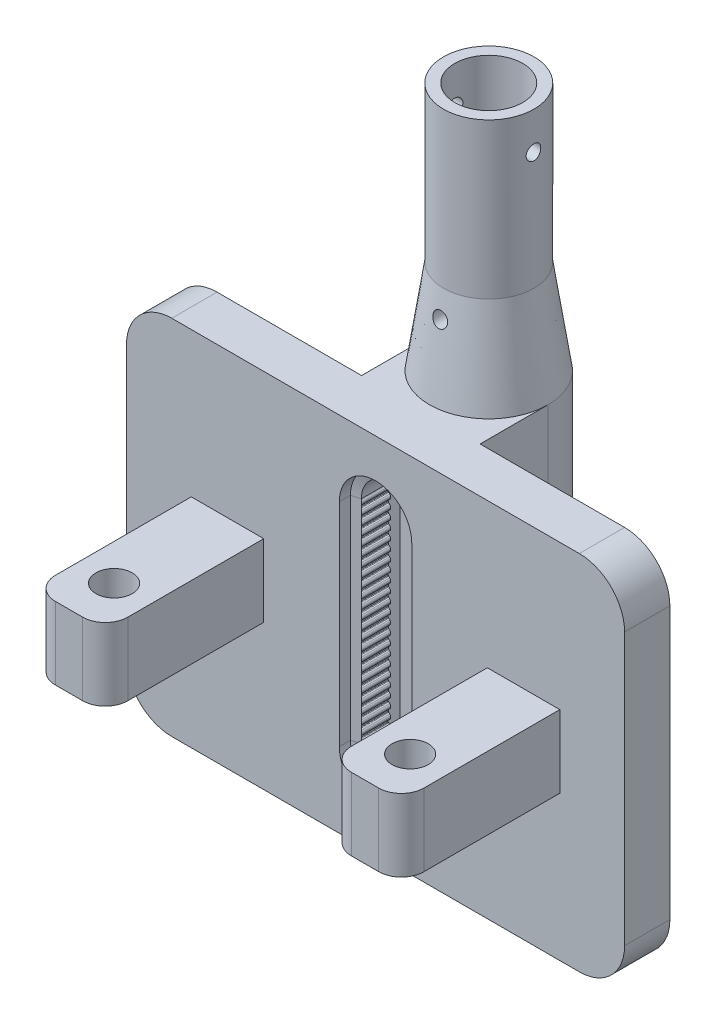
from build123d import *

# Parameters (mm, degrees)
SCHIZZO1_W                    = 110
SCHIZZO1_H                    = 80
ESTRUSIONE_ESTRUSIONE1_DEPTH  = 10
RACCORDO1_R                   = 10
SCHIZZO2_W                    = 12.22
SCHIZZO2_H                    = 55
ESTRUSIONE_ESTRUSIONE2_DEPTH  = 5
TAGLIO_ESTRUSIONE6_DEPTH      = 20
TAGLIO_ESTRUSIONE8_DEPTH      = 53
SCHIZZO14_R                   = 10
ESTRUSIONE_ESTRUSIONE5_DEPTH  = 135
SMUSSO1_SIZE                  = 2
SMUSSO1_SIZE2                 = 0.535898385
TAGLIO_ESTRUSIONE12_DEPTH     = 80
SMUSSO2_SIZE                  = 2
SMUSSO2_SIZE_2                = 0.535898385
ESTRUSIONE_ESTRUSIONE9_DEPTH  = 8
ESTRUSIONE_ESTRUSIONE10_DEPTH = 64
ESTRUSIONE_ESTRUSIONE11_DEPTH = 8
TAGLIO_ESTRUSIONE14_DEPTH     = 8
SCHIZZO32_W                   = 16
SCHIZZO32_H                   = 16
ESTRUSIONE_ESTRUSIONE13_DEPTH = 35
RACCORDO7_R                   = 5
SCHIZZO33_R                   = 4
TAGLIO_ESTRUSIONE16_DEPTH     = 35
RACCORDO7_OF_SPECCHIA1_R      = 5
SCHIZZO35_R                   = 7.5
TAGLIO_ESTRUSIONE17_DEPTH     = 47.44
SCHIZZO36_R                   = 1.62
TAGLIO_ESTRUSIONE18_DEPTH     = 45
SCHIZZO37_R                   = 1.62
TAGLIO_ESTRUSIONE19_DEPTH     = 22.5


with BuildPart() as part:
    # Schizzo1 → Estrusione-Estrusione1 (new body)
    with BuildSketch(Plane.XY):
        Rectangle(SCHIZZO1_W, SCHIZZO1_H)
    extrude(amount=ESTRUSIONE_ESTRUSIONE1_DEPTH)

    # Raccordo1
    raccordo1_edges = [part.edges().sort_by_distance(p)[0] for p in [
        (55, -40, 5),
        (-55, -40, 5),
        (-55, 40, 5),
        (55, 40, 5),
    ]]
    fillet(raccordo1_edges, radius=RACCORDO1_R)

    # Schizzo2 → Estrusione-Estrusione2 (add)
    with BuildSketch(Plane.XY.offset(10)):
        Rectangle(SCHIZZO2_W, SCHIZZO2_H)
    extrude(amount=-ESTRUSIONE_ESTRUSIONE2_DEPTH)

    # Schizzo6 → Taglio-Estrusione6 (cut)
    with BuildSketch(Plane.XY.offset(10)):
        with BuildLine():
            Line((-6.11, 21.385895057), (-6.11, -21.385895057))
            ThreePointArc((-6.11, -21.385895057), (0, -27.495895057), (6.11, -21.385895057))
            Line((6.11, -21.385895057), (6.11, 21.385895057))
            ThreePointArc((6.11, 21.385895057), (0, 27.495895057), (-6.11, 21.385895057))
        make_face()
    extrude(amount=-TAGLIO_ESTRUSIONE6_DEPTH, mode=Mode.SUBTRACT)

    # Schizzo9 → Taglio-Estrusione8 (cut)
    with BuildSketch(Plane(origin=(0, 0, 0), x_dir=(-1, 0, 0), z_dir=(0, 0, -1))):
        with BuildLine():
            Line((6.11, 23.431188104), (6.11, -23.431188104))
            ThreePointArc((6.11, -23.431188104), (0, -29.541188104), (-6.11, -23.431188104))
            Line((-6.11, -23.431188104), (-6.11, 23.431188104))
            ThreePointArc((-6.11, 23.431188104), (0, 29.541188104), (6.11, 23.431188104))
        make_face()
    extrude(amount=-TAGLIO_ESTRUSIONE8_DEPTH, mode=Mode.SUBTRACT)

    # Smusso1
    smusso1_edges = [part.edges().sort_by_distance(p)[0] for p in [
        (-6.11, 0, 0),
        (6.11, 0, 0),
        (0, 29.541188104, 0),
        (0, -29.541188104, 0),
    ]]
    smusso1_side = [part.faces().sort_by_distance(p)[0] for p in [
        (0, 38.639852949, 0),
    ]]
    chamfer(smusso1_edges, length=SMUSSO1_SIZE, length2=SMUSSO1_SIZE2, reference=smusso1_side[0])

    # Schizzo22 → Taglio-Estrusione12 (cut)
    with BuildSketch(Plane.XY.offset(7)):
        with BuildLine():
            Line((-8, 23.431188104), (-8, -23.431188104))
            ThreePointArc((-8, -23.431188104), (0, -31.431188104), (8, -23.431188104))
            Line((8, -23.431188104), (8, 23.431188104))
            ThreePointArc((8, 23.431188104), (0, 31.431188104), (-8, 23.431188104))
        make_face()
    extrude(amount=TAGLIO_ESTRUSIONE12_DEPTH, mode=Mode.SUBTRACT)

    # Smusso2
    # the kernel refuses this chamfer: 2, 0.535898385 mm, written as the material it adds along each edge
    with BuildSketch(Plane(origin=(0, -23.431188104, 7), x_dir=(-1, 0, 0), z_dir=(0, 1, 0))) as smusso2_piece_1_section:
        Polygon((8 - SMUSSO2_SIZE, 0), (8, SMUSSO2_SIZE_2), (8, 0), align=None)
    smusso2_piece_1 = revolve(axis=Axis((0, -23.431188104, 7), (0, 0, 1)), revolution_arc=180, mode=Mode.PRIVATE)
    smusso2_piece_1 = smusso2_piece_1 - Plane(origin=(0, -23.431188104, 7.272646598), x_dir=(-1, 0, 0), z_dir=(0, 0, -1)) * Cylinder(6.11, 32, mode=Mode.PRIVATE)
    add(smusso2_piece_1)
    with BuildSketch(Plane(origin=(-8, 23.431188104, 7), x_dir=(0.9999503267608395, 0, -0.009967146577156399), z_dir=(0, -1, 0))) as smusso2_piece_2_section:
        Polygon((SMUSSO2_SIZE * 0.999950326761, SMUSSO2_SIZE * 0.00996714657716), (-SMUSSO2_SIZE_2 * 0.00996714657459, SMUSSO2_SIZE_2 * 0.999950326504), (0, 0), align=None)
    smusso2_piece_2 = extrude(amount=46.862376207, mode=Mode.PRIVATE)
    smusso2_piece_2 = split(smusso2_piece_2, bisect_by=Plane(origin=(-6.11, 0, 7.161278996), z_dir=(-1, 0, 0)), keep=Keep.TOP, mode=Mode.PRIVATE)
    add(smusso2_piece_2)
    with BuildSketch(Plane(origin=(0, 23.431188104, 7), x_dir=(1, 0, 0), z_dir=(0, -1, 0))) as smusso2_piece_3_section:
        Polygon((8 - SMUSSO2_SIZE, 0), (8, SMUSSO2_SIZE_2), (8, 0), align=None)
    smusso2_piece_3 = revolve(axis=Axis((0, 23.431188104, 7), (0, 0, 1)), revolution_arc=180, mode=Mode.PRIVATE)
    smusso2_piece_3 = smusso2_piece_3 - Plane(origin=(0, 23.431188104, 7.272646598), x_dir=(1, 0, 0), z_dir=(0, 0, -1)) * Cylinder(6.11, 32, mode=Mode.PRIVATE)
    add(smusso2_piece_3)
    with BuildSketch(Plane(origin=(8, -23.431188104, 7), x_dir=(-0.9999503267608395, 0, -0.009967146577156399), z_dir=(0, 1, 0))) as smusso2_piece_4_section:
        Polygon((SMUSSO2_SIZE * 0.999950326761, SMUSSO2_SIZE * 0.00996714657716), (-SMUSSO2_SIZE_2 * 0.00996714657459, SMUSSO2_SIZE_2 * 0.999950326504), (0, 0), align=None)
    smusso2_piece_4 = extrude(amount=46.862376207, mode=Mode.PRIVATE)
    smusso2_piece_4 = split(smusso2_piece_4, bisect_by=Plane(origin=(6.11, 0, 7.161278996), z_dir=(1, 0, 0)), keep=Keep.TOP, mode=Mode.PRIVATE)
    add(smusso2_piece_4)



with BuildPart() as body_2:
    # Schizzo14 → Estrusione-Estrusione5 (new body)
    with BuildSketch(Plane(origin=(0, 95, 0), x_dir=(1, 0, 0), z_dir=(0, 1, 0))):
        with Locations(Location((0, 15, 0), (0, 0, 270))):
            Circle(SCHIZZO14_R)
    extrude(amount=-ESTRUSIONE_ESTRUSIONE5_DEPTH)


with BuildPart() as part_1:
    add(part.part)

    add(body_2.part)  # Estrusione-Estrusione9 merges body 2
    # Schizzo20 → Estrusione-Estrusione9 (add)
    with BuildSketch(Plane(origin=(0, -40, 0), x_dir=(1, 0, 0), z_dir=(0, 1, 0))):
        with BuildLine():
            Line((-13.086207835, 15), (-13.086207835, 0))
            Line((-13.086207835, 0), (13.086207835, 0))
            Line((13.086207835, 0), (13.086207835, 15))
            ThreePointArc((13.086207835, 15), (0, 28.086207835), (-13.086207835, 15))
        make_face()
    extrude(amount=ESTRUSIONE_ESTRUSIONE9_DEPTH)

    # Schizzo23 → Estrusione-Estrusione10 (add)
    with BuildSketch(Plane(origin=(0, -32, 0), x_dir=(1, 0, 0), z_dir=(0, 1, 0))):
        with BuildLine():
            Line((-13.086207835, 15), (-13.086207835, 0))
            Line((-13.086207835, 0), (-8.586207835, 0))
            Line((-8.586207835, 0), (-6.586207835, 2))
            Line((-6.586207835, 2), (6.586207835, 2))
            Line((6.586207835, 2), (8.586207835, 0))
            Line((8.586207835, 0), (13.086207835, 0))
            Line((13.086207835, 0), (13.086207835, 15))
            ThreePointArc((13.086207835, 15), (0, 28.086207835), (-13.086207835, 15))
        make_face()
    extrude(amount=ESTRUSIONE_ESTRUSIONE10_DEPTH)

    # Schizzo24 → Estrusione-Estrusione11 (add)
    with BuildSketch(Plane(origin=(0, 32, 0), x_dir=(1, 0, 0), z_dir=(0, 1, 0))):
        with BuildLine():
            Line((-13.086207835, 15), (-13.086207835, 0))
            Line((-13.086207835, 0), (13.086207835, 0))
            Line((13.086207835, 0), (13.086207835, 15))
            ThreePointArc((13.086207835, 15), (0, 28.086207835), (-13.086207835, 15))
        make_face()
    extrude(amount=ESTRUSIONE_ESTRUSIONE11_DEPTH)

    # Schizzo25 → Rivoluzione6 (revolve)
    with BuildSketch(Plane(origin=(0, 0, 0), x_dir=(0, 0, -1), z_dir=(1, 0, 0)), mode=Mode.PRIVATE) as rivoluzione6_sk:
        Polygon((15, 40), (28.086207835, 40), (25, 60.729020971), (15, 60.729020971), align=None)
    revolve(rivoluzione6_sk.sketch.rotate(Axis((0, 40, -15), (0, 1, 0)), 270), axis=Axis((0, 40, -15), (0, 1, 0)))

    # Schizzo26 → Taglio-Estrusione14 (cut)
    with BuildSketch(Plane.XY.offset(7)):
        with BuildLine():
            Line((1.378490081, -23.431477614), (-1.377875263, -23.43101277))
            Line((-1.377875263, -23.43101277), (-6.157754478, -23.43101277))
            ThreePointArc((-6.157754478, -23.43101277), (-6.265509908, -23.271432682), (-6.421299684, -23.158266507))
            ThreePointArc((-6.421299684, -23.158266507), (-6.571812894, -23.099373904), (-6.729849965, -23.065508738))
            ThreePointArc((-6.729849965, -23.065508738), (-6.822601249, -23.016000408), (-6.85965898, -22.917610368))
            Line((-6.85965898, -22.917610368), (-6.859693276, -22.393414393))
            ThreePointArc((-6.859693276, -22.393414393), (-6.82264842, -22.295019504), (-6.729903615, -22.245499038))
            ThreePointArc((-6.729903615, -22.245499038), (-6.571870977, -22.211613193), (-6.421365474, -22.152700895))
            ThreePointArc((-6.421365474, -22.152700895), (-6.109735126, -21.654479431), (-6.420236093, -21.155553333))
            ThreePointArc((-6.420236093, -21.155553333), (-6.57060776, -21.096300258), (-6.728563234, -21.062056521))
            ThreePointArc((-6.728563234, -21.062056521), (-6.821195626, -21.012326094), (-6.858017501, -20.913847543))
            Line((-6.858017501, -20.913847543), (-6.857406643, -20.651750267))
            Line((-6.857406643, -20.651750267), (-6.858017501, -20.389652991))
            ThreePointArc((-6.858017501, -20.389652991), (-6.821195626, -20.29117444), (-6.728563234, -20.241444013))
            ThreePointArc((-6.728563234, -20.241444013), (-6.57060776, -20.207200276), (-6.420236093, -20.147947201))
            ThreePointArc((-6.420236093, -20.147947201), (-6.109735126, -19.649021103), (-6.421365474, -19.150799639))
            ThreePointArc((-6.421365474, -19.150799639), (-6.571870977, -19.091887342), (-6.729903615, -19.058001496))
            ThreePointArc((-6.729903615, -19.058001496), (-6.82264842, -19.00848103), (-6.859693276, -18.910086141))
            Line((-6.859693276, -18.910086141), (-6.85965898, -18.385890166))
            ThreePointArc((-6.85965898, -18.385890166), (-6.822601249, -18.287500126), (-6.729849965, -18.237991796))
            ThreePointArc((-6.729849965, -18.237991796), (-6.571812894, -18.20412663), (-6.421299684, -18.145234027))
            ThreePointArc((-6.421299684, -18.145234027), (-6.109604144, -17.647053345), (-6.420039823, -17.148086622))
            ThreePointArc((-6.420039823, -17.148086622), (-6.570403735, -17.088813871), (-6.728354727, -17.054549464))
            ThreePointArc((-6.728354727, -17.054549464), (-6.820980611, -17.004806917), (-6.857789599, -16.906323549))
            Line((-6.857789599, -16.906323549), (-6.857144445, -16.644226355))
            Line((-6.857144445, -16.644226355), (-6.857789599, -16.382129161))
            ThreePointArc((-6.857789599, -16.382129161), (-6.820980611, -16.283645792), (-6.728354727, -16.233903245))
            ThreePointArc((-6.728354727, -16.233903245), (-6.570403735, -16.199638839), (-6.420039823, -16.140366088))
            ThreePointArc((-6.420039823, -16.140366088), (-6.109604144, -15.641399364), (-6.421299684, -15.143218682))
            ThreePointArc((-6.421299684, -15.143218682), (-6.571812894, -15.084326079), (-6.729849965, -15.050460913))
            ThreePointArc((-6.729849965, -15.050460913), (-6.822601249, -15.000952583), (-6.85965898, -14.902562543))
            Line((-6.85965898, -14.902562543), (-6.859693276, -14.378366568))
            ThreePointArc((-6.859693276, -14.378366568), (-6.82264842, -14.27997168), (-6.729903615, -14.230451213))
            ThreePointArc((-6.729903615, -14.230451213), (-6.571870977, -14.196565368), (-6.421365474, -14.13765307))
            ThreePointArc((-6.421365474, -14.13765307), (-6.109735126, -13.639431606), (-6.420236093, -13.140505508))
            ThreePointArc((-6.420236093, -13.140505508), (-6.57060776, -13.081252434), (-6.728563234, -13.047008696))
            ThreePointArc((-6.728563234, -13.047008696), (-6.821195626, -12.997278269), (-6.858017501, -12.898799718))
            Line((-6.858017501, -12.898799718), (-6.857406643, -12.636702442))
            Line((-6.857406643, -12.636702442), (-6.858017501, -12.374605166))
            ThreePointArc((-6.858017501, -12.374605166), (-6.821195626, -12.276126615), (-6.728563234, -12.226396188))
            ThreePointArc((-6.728563234, -12.226396188), (-6.57060776, -12.192152451), (-6.420236093, -12.132899376))
            ThreePointArc((-6.420236093, -12.132899376), (-6.109735126, -11.633973278), (-6.421365474, -11.135751814))
            ThreePointArc((-6.421365474, -11.135751814), (-6.571870977, -11.076839517), (-6.729903615, -11.042953671))
            ThreePointArc((-6.729903615, -11.042953671), (-6.82264842, -10.993433205), (-6.859693276, -10.895038316))
            Line((-6.859693276, -10.895038316), (-6.85965898, -10.370842341))
            ThreePointArc((-6.85965898, -10.370842341), (-6.822601249, -10.272452301), (-6.729849965, -10.222943971))
            ThreePointArc((-6.729849965, -10.222943971), (-6.571812894, -10.189078805), (-6.421299684, -10.130186202))
            ThreePointArc((-6.421299684, -10.130186202), (-6.109604144, -9.63200552), (-6.420039823, -9.133038797))
            ThreePointArc((-6.420039823, -9.133038797), (-6.570403735, -9.073766046), (-6.728354727, -9.03950164))
            ThreePointArc((-6.728354727, -9.03950164), (-6.820980611, -8.989759092), (-6.857789599, -8.891275724))
            Line((-6.857789599, -8.891275724), (-6.857144445, -8.62917853))
            Line((-6.857144445, -8.62917853), (-6.857789599, -8.367081336))
            ThreePointArc((-6.857789599, -8.367081336), (-6.820980611, -8.268597967), (-6.728354727, -8.21885542))
            ThreePointArc((-6.728354727, -8.21885542), (-6.570403735, -8.184591014), (-6.420039823, -8.125318263))
            ThreePointArc((-6.420039823, -8.125318263), (-6.109604144, -7.62635154), (-6.421299684, -7.128170858))
            ThreePointArc((-6.421299684, -7.128170858), (-6.571812894, -7.069278254), (-6.729849965, -7.035413088))
            ThreePointArc((-6.729849965, -7.035413088), (-6.822601249, -6.985904758), (-6.85965898, -6.887514718))
            Line((-6.85965898, -6.887514718), (-6.859693276, -6.363318743))
            ThreePointArc((-6.859693276, -6.363318743), (-6.82264842, -6.264923855), (-6.729903615, -6.215403388))
            ThreePointArc((-6.729903615, -6.215403388), (-6.571870977, -6.181517543), (-6.421365474, -6.122605245))
            ThreePointArc((-6.421365474, -6.122605245), (-6.109735126, -5.624383781), (-6.420236093, -5.125457684))
            ThreePointArc((-6.420236093, -5.125457684), (-6.57060776, -5.066204609), (-6.728563234, -5.031960871))
            ThreePointArc((-6.728563234, -5.031960871), (-6.821195626, -4.982230444), (-6.858017501, -4.883751893))
            Line((-6.858017501, -4.883751893), (-6.857406643, -4.621654617))
            Line((-6.857406643, -4.621654617), (-6.858017501, -4.359557341))
            ThreePointArc((-6.858017501, -4.359557341), (-6.821195626, -4.26107879), (-6.728563234, -4.211348363))
            ThreePointArc((-6.728563234, -4.211348363), (-6.57060776, -4.177104626), (-6.420236093, -4.117851551))
            ThreePointArc((-6.420236093, -4.117851551), (-6.109735126, -3.618925453), (-6.421365474, -3.120703989))
            ThreePointArc((-6.421365474, -3.120703989), (-6.571870977, -3.061791692), (-6.729903615, -3.027905846))
            ThreePointArc((-6.729903615, -3.027905846), (-6.82264842, -2.97838538), (-6.859693276, -2.879990491))
            Line((-6.859693276, -2.879990491), (-6.85965898, -2.355794517))
            ThreePointArc((-6.85965898, -2.355794517), (-6.822601249, -2.257404476), (-6.729849965, -2.207896146))
            ThreePointArc((-6.729849965, -2.207896146), (-6.571812894, -2.17403098), (-6.421299684, -2.115138377))
            ThreePointArc((-6.421299684, -2.115138377), (-6.109604144, -1.616957695), (-6.420039823, -1.117990972))
            ThreePointArc((-6.420039823, -1.117990972), (-6.570403735, -1.058718221), (-6.728354727, -1.024453815))
            ThreePointArc((-6.728354727, -1.024453815), (-6.820980611, -0.974711267), (-6.857789599, -0.876227899))
            Line((-6.857789599, -0.876227899), (-6.857144445, -0.614130705))
            Line((-6.857144445, -0.614130705), (-6.857789599, -0.352033511))
            ThreePointArc((-6.857789599, -0.352033511), (-6.820980611, -0.253550143), (-6.728354727, -0.203807595))
            ThreePointArc((-6.728354727, -0.203807595), (-6.570403735, -0.169543189), (-6.420039823, -0.110270438))
            ThreePointArc((-6.420039823, -0.110270438), (-6.109604144, 0.388696285), (-6.421299684, 0.886876967))
            ThreePointArc((-6.421299684, 0.886876967), (-6.571812894, 0.945769571), (-6.729849965, 0.979634737))
            ThreePointArc((-6.729849965, 0.979634737), (-6.822601249, 1.029143067), (-6.85965898, 1.127533107))
            Line((-6.85965898, 1.127533107), (-6.859693276, 1.651729082))
            ThreePointArc((-6.859693276, 1.651729082), (-6.82264842, 1.75012397), (-6.729903615, 1.799644437))
            ThreePointArc((-6.729903615, 1.799644437), (-6.571870977, 1.833530282), (-6.421365474, 1.89244258))
            ThreePointArc((-6.421365474, 1.89244258), (-6.109735126, 2.390664044), (-6.420236093, 2.889590141))
            ThreePointArc((-6.420236093, 2.889590141), (-6.57060776, 2.948843216), (-6.728563234, 2.983086954))
            ThreePointArc((-6.728563234, 2.983086954), (-6.821195626, 3.032817381), (-6.858017501, 3.131295932))
            Line((-6.858017501, 3.131295932), (-6.857406643, 3.393393208))
            Line((-6.857406643, 3.393393208), (-6.858017501, 3.655490484))
            ThreePointArc((-6.858017501, 3.655490484), (-6.821195626, 3.753969035), (-6.728563234, 3.803699462))
            ThreePointArc((-6.728563234, 3.803699462), (-6.57060776, 3.837943199), (-6.420236093, 3.897196274))
            ThreePointArc((-6.420236093, 3.897196274), (-6.109735126, 4.396122372), (-6.421365474, 4.894343835))
            ThreePointArc((-6.421365474, 4.894343835), (-6.571870977, 4.953256133), (-6.729903615, 4.987141979))
            ThreePointArc((-6.729903615, 4.987141979), (-6.82264842, 5.036662445), (-6.859693276, 5.135057334))
            Line((-6.859693276, 5.135057334), (-6.85965898, 5.659253308))
            ThreePointArc((-6.85965898, 5.659253308), (-6.822601249, 5.757643349), (-6.729849965, 5.807151679))
            ThreePointArc((-6.729849965, 5.807151679), (-6.571812894, 5.841016845), (-6.421299684, 5.899909448))
            ThreePointArc((-6.421299684, 5.899909448), (-6.109604144, 6.39809013), (-6.420039823, 6.897056853))
            ThreePointArc((-6.420039823, 6.897056853), (-6.570403735, 6.956329604), (-6.728354727, 6.99059401))
            ThreePointArc((-6.728354727, 6.99059401), (-6.820980611, 7.040336558), (-6.857789599, 7.138819926))
            Line((-6.857789599, 7.138819926), (-6.857144445, 7.40091712))
            Line((-6.857144445, 7.40091712), (-6.857789599, 7.663014314))
            ThreePointArc((-6.857789599, 7.663014314), (-6.820980611, 7.761497682), (-6.728354727, 7.81124023))
            ThreePointArc((-6.728354727, 7.81124023), (-6.570403735, 7.845504636), (-6.420039823, 7.904777387))
            ThreePointArc((-6.420039823, 7.904777387), (-6.109604144, 8.40374411), (-6.421299684, 8.901924792))
            ThreePointArc((-6.421299684, 8.901924792), (-6.571812894, 8.960817395), (-6.729849965, 8.994682562))
            ThreePointArc((-6.729849965, 8.994682562), (-6.822601249, 9.044190892), (-6.85965898, 9.142580932))
            Line((-6.85965898, 9.142580932), (-6.859693276, 9.666776907))
            ThreePointArc((-6.859693276, 9.666776907), (-6.82264842, 9.765171795), (-6.729903615, 9.814692262))
            ThreePointArc((-6.729903615, 9.814692262), (-6.571870977, 9.848578107), (-6.421365474, 9.907490405))
            ThreePointArc((-6.421365474, 9.907490405), (-6.109735126, 10.405711869), (-6.420236093, 10.904637966))
            ThreePointArc((-6.420236093, 10.904637966), (-6.57060776, 10.963891041), (-6.728563234, 10.998134779))
            ThreePointArc((-6.728563234, 10.998134779), (-6.821195626, 11.047865206), (-6.858017501, 11.146343757))
            Line((-6.858017501, 11.146343757), (-6.857406643, 11.408441033))
            Line((-6.857406643, 11.408441033), (-6.858017501, 11.670538309))
            ThreePointArc((-6.858017501, 11.670538309), (-6.821195626, 11.76901686), (-6.728563234, 11.818747286))
            ThreePointArc((-6.728563234, 11.818747286), (-6.57060776, 11.852991024), (-6.420236093, 11.912244099))
            ThreePointArc((-6.420236093, 11.912244099), (-6.109735126, 12.411170197), (-6.421365474, 12.90939166))
            ThreePointArc((-6.421365474, 12.90939166), (-6.571870977, 12.968303958), (-6.729903615, 13.002189804))
            ThreePointArc((-6.729903615, 13.002189804), (-6.82264842, 13.05171027), (-6.859693276, 13.150105159))
            Line((-6.859693276, 13.150105159), (-6.85965898, 13.674301133))
            ThreePointArc((-6.85965898, 13.674301133), (-6.822601249, 13.772691174), (-6.729849965, 13.822199504))
            ThreePointArc((-6.729849965, 13.822199504), (-6.571812894, 13.85606467), (-6.421299684, 13.914957273))
            ThreePointArc((-6.421299684, 13.914957273), (-6.109604144, 14.413137955), (-6.420039823, 14.912104678))
            ThreePointArc((-6.420039823, 14.912104678), (-6.570403735, 14.971377429), (-6.728354727, 15.005641835))
            ThreePointArc((-6.728354727, 15.005641835), (-6.820980611, 15.055384383), (-6.857789599, 15.153867751))
            Line((-6.857789599, 15.153867751), (-6.857144445, 15.415964945))
            Line((-6.857144445, 15.415964945), (-6.857789599, 15.678062139))
            ThreePointArc((-6.857789599, 15.678062139), (-6.820980611, 15.776545507), (-6.728354727, 15.826288055))
            ThreePointArc((-6.728354727, 15.826288055), (-6.570403735, 15.860552461), (-6.420039823, 15.919825212))
            ThreePointArc((-6.420039823, 15.919825212), (-6.109604144, 16.418791935), (-6.421299684, 16.916972617))
            ThreePointArc((-6.421299684, 16.916972617), (-6.571812894, 16.97586522), (-6.729849965, 17.009730387))
            ThreePointArc((-6.729849965, 17.009730387), (-6.822601249, 17.059238717), (-6.85965898, 17.157628757))
            Line((-6.85965898, 17.157628757), (-6.859693276, 17.681824732))
            ThreePointArc((-6.859693276, 17.681824732), (-6.82264842, 17.78021962), (-6.729903615, 17.829740087))
            ThreePointArc((-6.729903615, 17.829740087), (-6.571870977, 17.863625932), (-6.421365474, 17.92253823))
            ThreePointArc((-6.421365474, 17.92253823), (-6.109735126, 18.420759694), (-6.420236093, 18.919685791))
            ThreePointArc((-6.420236093, 18.919685791), (-6.57060776, 18.978938866), (-6.728563234, 19.013182604))
            ThreePointArc((-6.728563234, 19.013182604), (-6.821195626, 19.062913031), (-6.858017501, 19.161391581))
            Line((-6.858017501, 19.161391581), (-6.857406643, 19.423488858))
            Line((-6.857406643, 19.423488858), (-6.858017501, 19.685586134))
            ThreePointArc((-6.858017501, 19.685586134), (-6.821195626, 19.784064685), (-6.728563234, 19.833795111))
            ThreePointArc((-6.728563234, 19.833795111), (-6.57060776, 19.868038849), (-6.420236093, 19.927291924))
            ThreePointArc((-6.420236093, 19.927291924), (-6.109735126, 20.426218021), (-6.421365474, 20.924439485))
            ThreePointArc((-6.421365474, 20.924439485), (-6.571870977, 20.983351783), (-6.729903615, 21.017237629))
            ThreePointArc((-6.729903615, 21.017237629), (-6.82264842, 21.066758095), (-6.859693276, 21.165152983))
            Line((-6.859693276, 21.165152983), (-6.85965898, 21.689348958))
            ThreePointArc((-6.85965898, 21.689348958), (-6.822601249, 21.787738998), (-6.729849965, 21.837247329))
            ThreePointArc((-6.729849965, 21.837247329), (-6.571812894, 21.871112495), (-6.421299684, 21.930005098))
            ThreePointArc((-6.421299684, 21.930005098), (-6.109603729, 22.428711781), (-6.420984572, 22.927615272))
            ThreePointArc((-6.420984572, 22.927615272), (-6.571054254, 22.98668083), (-6.728669487, 23.020843496))
            ThreePointArc((-6.728669487, 23.020843496), (-6.821295623, 23.070586466), (-6.858104224, 23.16907043))
            Line((-6.858104224, 23.16907043), (-6.85745907, 23.431167623))
            Line((-6.85745907, 23.431167623), (1.378490081, 23.430898593))
            Line((1.378490081, 23.430898593), (6.858073888, 23.430856638))
            Line((6.858073888, 23.430856638), (6.858719042, 23.168759444))
            ThreePointArc((6.858719042, 23.168759444), (6.821910054, 23.070276076), (6.72928417, 23.020533528))
            ThreePointArc((6.72928417, 23.020533528), (6.571333178, 22.986269122), (6.420969265, 22.926996371))
            ThreePointArc((6.420969265, 22.926996371), (6.109903519, 22.428071603), (6.42159939, 21.929540254))
            ThreePointArc((6.42159939, 21.929540254), (6.572112601, 21.870647651), (6.730149672, 21.836782484))
            ThreePointArc((6.730149672, 21.836782484), (6.822900956, 21.787274154), (6.859958687, 21.688884114))
            Line((6.859958687, 21.688884114), (6.859992983, 21.164688139))
            ThreePointArc((6.859992983, 21.164688139), (6.822948127, 21.066293251), (6.730203322, 21.016772785))
            ThreePointArc((6.730203322, 21.016772785), (6.572170684, 20.982886939), (6.421665181, 20.923974641))
            ThreePointArc((6.421665181, 20.923974641), (6.110034832, 20.425753177), (6.420535799, 19.92682708))
            ThreePointArc((6.420535799, 19.92682708), (6.570907467, 19.867574005), (6.728862941, 19.833330267))
            ThreePointArc((6.728862941, 19.833330267), (6.821495333, 19.78359984), (6.858317208, 19.68512129))
            Line((6.858317208, 19.68512129), (6.857706349, 19.423024014))
            Line((6.857706349, 19.423024014), (6.858317208, 19.160926737))
            ThreePointArc((6.858317208, 19.160926737), (6.821495333, 19.062448187), (6.728862941, 19.01271776))
            ThreePointArc((6.728862941, 19.01271776), (6.570907467, 18.978474022), (6.420535799, 18.919220947))
            ThreePointArc((6.420535799, 18.919220947), (6.110034832, 18.42029485), (6.421665181, 17.922073386))
            ThreePointArc((6.421665181, 17.922073386), (6.572170684, 17.863161088), (6.730203322, 17.829275242))
            ThreePointArc((6.730203322, 17.829275242), (6.822948127, 17.779754776), (6.859992983, 17.681359888))
            Line((6.859992983, 17.681359888), (6.859958687, 17.157163913))
            ThreePointArc((6.859958687, 17.157163913), (6.822900956, 17.058773873), (6.730149672, 17.009265543))
            ThreePointArc((6.730149672, 17.009265543), (6.572112601, 16.975400376), (6.42159939, 16.916507773))
            ThreePointArc((6.42159939, 16.916507773), (6.109903851, 16.418327091), (6.420339529, 15.919360368))
            ThreePointArc((6.420339529, 15.919360368), (6.570703442, 15.860087617), (6.728654434, 15.825823211))
            ThreePointArc((6.728654434, 15.825823211), (6.821280318, 15.776080663), (6.858089306, 15.677597295))
            Line((6.858089306, 15.677597295), (6.857444152, 15.415500101))
            Line((6.857444152, 15.415500101), (6.858089306, 15.153402907))
            ThreePointArc((6.858089306, 15.153402907), (6.821280318, 15.054919539), (6.728654434, 15.005176991))
            ThreePointArc((6.728654434, 15.005176991), (6.570703442, 14.970912585), (6.420339529, 14.911639834))
            ThreePointArc((6.420339529, 14.911639834), (6.109903851, 14.412673111), (6.42159939, 13.914492429))
            ThreePointArc((6.42159939, 13.914492429), (6.572112601, 13.855599826), (6.730149672, 13.82173466))
            ThreePointArc((6.730149672, 13.82173466), (6.822900956, 13.772226329), (6.859958687, 13.673836289))
            Line((6.859958687, 13.673836289), (6.859992983, 13.149640314))
            ThreePointArc((6.859992983, 13.149640314), (6.822948127, 13.051245426), (6.730203322, 13.00172496))
            ThreePointArc((6.730203322, 13.00172496), (6.572170684, 12.967839114), (6.421665181, 12.908926816))
            ThreePointArc((6.421665181, 12.908926816), (6.110034832, 12.410705352), (6.420535799, 11.911779255))
            ThreePointArc((6.420535799, 11.911779255), (6.570907467, 11.85252618), (6.728862941, 11.818282442))
            ThreePointArc((6.728862941, 11.818282442), (6.821495333, 11.768552016), (6.858317208, 11.670073465))
            Line((6.858317208, 11.670073465), (6.857706349, 11.407976189))
            Line((6.857706349, 11.407976189), (6.858317208, 11.145878912))
            ThreePointArc((6.858317208, 11.145878912), (6.821495333, 11.047400362), (6.728862941, 10.997669935))
            ThreePointArc((6.728862941, 10.997669935), (6.570907467, 10.963426197), (6.420535799, 10.904173122))
            ThreePointArc((6.420535799, 10.904173122), (6.110034832, 10.405247025), (6.421665181, 9.907025561))
            ThreePointArc((6.421665181, 9.907025561), (6.572170684, 9.848113263), (6.730203322, 9.814227418))
            ThreePointArc((6.730203322, 9.814227418), (6.822948127, 9.764706951), (6.859992983, 9.666312063))
            Line((6.859992983, 9.666312063), (6.859958687, 9.142116088))
            ThreePointArc((6.859958687, 9.142116088), (6.822900956, 9.043726048), (6.730149672, 8.994217718))
            ThreePointArc((6.730149672, 8.994217718), (6.572112601, 8.960352551), (6.42159939, 8.901459948))
            ThreePointArc((6.42159939, 8.901459948), (6.109903851, 8.403279266), (6.420339529, 7.904312543))
            ThreePointArc((6.420339529, 7.904312543), (6.570703442, 7.845039792), (6.728654434, 7.810775386))
            ThreePointArc((6.728654434, 7.810775386), (6.821280318, 7.761032838), (6.858089306, 7.66254947))
            Line((6.858089306, 7.66254947), (6.857444152, 7.400452276))
            Line((6.857444152, 7.400452276), (6.858089306, 7.138355082))
            ThreePointArc((6.858089306, 7.138355082), (6.821280318, 7.039871714), (6.728654434, 6.990129166))
            ThreePointArc((6.728654434, 6.990129166), (6.570703442, 6.95586476), (6.420339529, 6.896592009))
            ThreePointArc((6.420339529, 6.896592009), (6.109903851, 6.397625286), (6.42159939, 5.899444604))
            ThreePointArc((6.42159939, 5.899444604), (6.572112601, 5.840552001), (6.730149672, 5.806686835))
            ThreePointArc((6.730149672, 5.806686835), (6.822900956, 5.757178505), (6.859958687, 5.658788464))
            Line((6.859958687, 5.658788464), (6.859992983, 5.13459249))
            ThreePointArc((6.859992983, 5.13459249), (6.822948127, 5.036197601), (6.730203322, 4.986677135))
            ThreePointArc((6.730203322, 4.986677135), (6.572170684, 4.952791289), (6.421665181, 4.893878991))
            ThreePointArc((6.421665181, 4.893878991), (6.110034832, 4.395657528), (6.420535799, 3.89673143))
            ThreePointArc((6.420535799, 3.89673143), (6.570907467, 3.837478355), (6.728862941, 3.803234618))
            ThreePointArc((6.728862941, 3.803234618), (6.821495333, 3.753504191), (6.858317208, 3.65502564))
            Line((6.858317208, 3.65502564), (6.857706349, 3.392928364))
            Line((6.857706349, 3.392928364), (6.858317208, 3.130831088))
            ThreePointArc((6.858317208, 3.130831088), (6.821495333, 3.032352537), (6.728862941, 2.98262211))
            ThreePointArc((6.728862941, 2.98262211), (6.570907467, 2.948378372), (6.420535799, 2.889125297))
            ThreePointArc((6.420535799, 2.889125297), (6.110034832, 2.3901992), (6.421665181, 1.891977736))
            ThreePointArc((6.421665181, 1.891977736), (6.572170684, 1.833065438), (6.730203322, 1.799179593))
            ThreePointArc((6.730203322, 1.799179593), (6.822948127, 1.749659126), (6.859992983, 1.651264238))
            Line((6.859992983, 1.651264238), (6.859958687, 1.127068263))
            ThreePointArc((6.859958687, 1.127068263), (6.822900956, 1.028678223), (6.730149672, 0.979169893))
            ThreePointArc((6.730149672, 0.979169893), (6.572112601, 0.945304727), (6.42159939, 0.886412123))
            ThreePointArc((6.42159939, 0.886412123), (6.109903851, 0.388231441), (6.420339529, -0.110735282))
            ThreePointArc((6.420339529, -0.110735282), (6.570703442, -0.170008033), (6.728654434, -0.204272439))
            ThreePointArc((6.728654434, -0.204272439), (6.821280318, -0.254014987), (6.858089306, -0.352498355))
            Line((6.858089306, -0.352498355), (6.857444152, -0.614595549))
            Line((6.857444152, -0.614595549), (6.858089306, -0.876692743))
            ThreePointArc((6.858089306, -0.876692743), (6.821280318, -0.975176111), (6.728654434, -1.024918659))
            ThreePointArc((6.728654434, -1.024918659), (6.570703442, -1.059183065), (6.420339529, -1.118455816))
            ThreePointArc((6.420339529, -1.118455816), (6.109903851, -1.617422539), (6.42159939, -2.115603221))
            ThreePointArc((6.42159939, -2.115603221), (6.572112601, -2.174495824), (6.730149672, -2.20836099))
            ThreePointArc((6.730149672, -2.20836099), (6.822900956, -2.25786932), (6.859958687, -2.356259361))
            Line((6.859958687, -2.356259361), (6.859992983, -2.880455335))
            ThreePointArc((6.859992983, -2.880455335), (6.822948127, -2.978850224), (6.730203322, -3.02837069))
            ThreePointArc((6.730203322, -3.02837069), (6.572170684, -3.062256536), (6.421665181, -3.121168833))
            ThreePointArc((6.421665181, -3.121168833), (6.110034832, -3.619390297), (6.420535799, -4.118316395))
            ThreePointArc((6.420535799, -4.118316395), (6.570907467, -4.17756947), (6.728862941, -4.211813207))
            ThreePointArc((6.728862941, -4.211813207), (6.821495333, -4.261543634), (6.858317208, -4.360022185))
            Line((6.858317208, -4.360022185), (6.857706349, -4.622119461))
            Line((6.857706349, -4.622119461), (6.858317208, -4.884216737))
            ThreePointArc((6.858317208, -4.884216737), (6.821495333, -4.982695288), (6.728862941, -5.032425715))
            ThreePointArc((6.728862941, -5.032425715), (6.570907467, -5.066669453), (6.420535799, -5.125922528))
            ThreePointArc((6.420535799, -5.125922528), (6.110034832, -5.624848625), (6.421665181, -6.123070089))
            ThreePointArc((6.421665181, -6.123070089), (6.572170684, -6.181982387), (6.730203322, -6.215868232))
            ThreePointArc((6.730203322, -6.215868232), (6.822948127, -6.265388699), (6.859992983, -6.363783587))
            Line((6.859992983, -6.363783587), (6.859958687, -6.887979562))
            ThreePointArc((6.859958687, -6.887979562), (6.822900956, -6.986369602), (6.730149672, -7.035877932))
            ThreePointArc((6.730149672, -7.035877932), (6.572112601, -7.069743098), (6.42159939, -7.128635702))
            ThreePointArc((6.42159939, -7.128635702), (6.109903851, -7.626816384), (6.420339529, -8.125783107))
            ThreePointArc((6.420339529, -8.125783107), (6.570703442, -8.185055858), (6.728654434, -8.219320264))
            ThreePointArc((6.728654434, -8.219320264), (6.821280318, -8.269062812), (6.858089306, -8.36754618))
            Line((6.858089306, -8.36754618), (6.857444152, -8.629643374))
            Line((6.857444152, -8.629643374), (6.858089306, -8.891740568))
            ThreePointArc((6.858089306, -8.891740568), (6.821280318, -8.990223936), (6.728654434, -9.039966484))
            ThreePointArc((6.728654434, -9.039966484), (6.570703442, -9.07423089), (6.420339529, -9.133503641))
            ThreePointArc((6.420339529, -9.133503641), (6.109903851, -9.632470364), (6.42159939, -10.130651046))
            ThreePointArc((6.42159939, -10.130651046), (6.572112601, -10.189543649), (6.730149672, -10.223408815))
            ThreePointArc((6.730149672, -10.223408815), (6.822900956, -10.272917145), (6.859958687, -10.371307185))
            Line((6.859958687, -10.371307185), (6.859992983, -10.89550316))
            ThreePointArc((6.859992983, -10.89550316), (6.822948127, -10.993898049), (6.730203322, -11.043418515))
            ThreePointArc((6.730203322, -11.043418515), (6.572170684, -11.077304361), (6.421665181, -11.136216658))
            ThreePointArc((6.421665181, -11.136216658), (6.110034832, -11.634438122), (6.420535799, -12.13336422))
            ThreePointArc((6.420535799, -12.13336422), (6.570907467, -12.192617295), (6.728862941, -12.226861032))
            ThreePointArc((6.728862941, -12.226861032), (6.821495333, -12.276591459), (6.858317208, -12.37507001))
            Line((6.858317208, -12.37507001), (6.857706349, -12.637167286))
            Line((6.857706349, -12.637167286), (6.858317208, -12.899264562))
            ThreePointArc((6.858317208, -12.899264562), (6.821495333, -12.997743113), (6.728862941, -13.04747354))
            ThreePointArc((6.728862941, -13.04747354), (6.570907467, -13.081717278), (6.420535799, -13.140970353))
            ThreePointArc((6.420535799, -13.140970353), (6.110034832, -13.63989645), (6.421665181, -14.138117914))
            ThreePointArc((6.421665181, -14.138117914), (6.572170684, -14.197030212), (6.730203322, -14.230916057))
            ThreePointArc((6.730203322, -14.230916057), (6.822948127, -14.280436524), (6.859992983, -14.378831412))
            Line((6.859992983, -14.378831412), (6.859958687, -14.903027387))
            ThreePointArc((6.859958687, -14.903027387), (6.822900956, -15.001417427), (6.730149672, -15.050925757))
            ThreePointArc((6.730149672, -15.050925757), (6.572112601, -15.084790923), (6.42159939, -15.143683527))
            ThreePointArc((6.42159939, -15.143683527), (6.109903851, -15.641864208), (6.420339529, -16.140830932))
            ThreePointArc((6.420339529, -16.140830932), (6.570703442, -16.200103683), (6.728654434, -16.234368089))
            ThreePointArc((6.728654434, -16.234368089), (6.821280318, -16.284110636), (6.858089306, -16.382594005))
            Line((6.858089306, -16.382594005), (6.857444152, -16.644691199))
            Line((6.857444152, -16.644691199), (6.858089306, -16.906788393))
            ThreePointArc((6.858089306, -16.906788393), (6.821280318, -17.005271761), (6.728654434, -17.055014308))
            ThreePointArc((6.728654434, -17.055014308), (6.570703442, -17.089278715), (6.420339529, -17.148551466))
            ThreePointArc((6.420339529, -17.148551466), (6.109903851, -17.647518189), (6.42159939, -18.145698871))
            ThreePointArc((6.42159939, -18.145698871), (6.572112601, -18.204591474), (6.730149672, -18.23845664))
            ThreePointArc((6.730149672, -18.23845664), (6.822900956, -18.28796497), (6.859958687, -18.38635501))
            Line((6.859958687, -18.38635501), (6.859992983, -18.910550985))
            ThreePointArc((6.859992983, -18.910550985), (6.822948127, -19.008945874), (6.730203322, -19.05846634))
            ThreePointArc((6.730203322, -19.05846634), (6.572170684, -19.092352186), (6.421665181, -19.151264483))
            ThreePointArc((6.421665181, -19.151264483), (6.110034832, -19.649485947), (6.420535799, -20.148412045))
            ThreePointArc((6.420535799, -20.148412045), (6.570907467, -20.20766512), (6.728862941, -20.241908857))
            ThreePointArc((6.728862941, -20.241908857), (6.821495333, -20.291639284), (6.858317208, -20.390117835))
            Line((6.858317208, -20.390117835), (6.857706349, -20.652215111))
            Line((6.857706349, -20.652215111), (6.858317208, -20.914312387))
            ThreePointArc((6.858317208, -20.914312387), (6.821495333, -21.012790938), (6.728862941, -21.062521365))
            ThreePointArc((6.728862941, -21.062521365), (6.570907467, -21.096765102), (6.420535799, -21.156018177))
            ThreePointArc((6.420535799, -21.156018177), (6.110034832, -21.654944275), (6.421665181, -22.153165739))
            ThreePointArc((6.421665181, -22.153165739), (6.572170684, -22.212078037), (6.730203322, -22.245963882))
            ThreePointArc((6.730203322, -22.245963882), (6.822948127, -22.295484349), (6.859992983, -22.393879237))
            Line((6.859992983, -22.393879237), (6.859958687, -22.918075212))
            ThreePointArc((6.859958687, -22.918075212), (6.822900956, -23.016465252), (6.730149672, -23.065973582))
            ThreePointArc((6.730149672, -23.065973582), (6.572112601, -23.099838748), (6.42159939, -23.158731351))
            ThreePointArc((6.42159939, -23.158731351), (6.265809615, -23.271897526), (6.158054185, -23.431477614))
            Line((6.158054185, -23.431477614), (1.378490081, -23.431477614))
        make_face()
    extrude(amount=-TAGLIO_ESTRUSIONE14_DEPTH, mode=Mode.SUBTRACT)

    # Schizzo32 → Estrusione-Estrusione13 (add)
    with BuildSketch(Plane.XY.offset(10)):
        with Locations((-32.69, 0)):
            Rectangle(SCHIZZO32_W, SCHIZZO32_H)
    estrusione_estrusione13 = extrude(amount=ESTRUSIONE_ESTRUSIONE13_DEPTH)

    # Raccordo7
    raccordo7_edges = [part_1.edges().sort_by_distance(p)[0] for p in [
        (-24.69, 0, 45),
        (-40.69, 0, 45),
    ]]
    fillet(raccordo7_edges, radius=RACCORDO7_R)

    # Schizzo33 → Taglio-Estrusione16 (cut)
    with BuildSketch(Plane(origin=(0, 8, 0), x_dir=(1, 0, 0), z_dir=(0, 1, 0))):
        with Locations(Location((-32.69, -35.05, 0), (0, 0, 180))):
            Circle(SCHIZZO33_R)
    taglio_estrusione16 = extrude(amount=-TAGLIO_ESTRUSIONE16_DEPTH, mode=Mode.SUBTRACT)

    # Specchia1: Estrusione-Estrusione13, Taglio-Estrusione16 across plane
    add(estrusione_estrusione13.mirror(Plane(origin=(0, 0, 0), x_dir=(0, 0, 1), z_dir=(1, 0, 0))))
    add(taglio_estrusione16.mirror(Plane(origin=(0, 0, 0), x_dir=(0, 0, 1), z_dir=(1, 0, 0))), mode=Mode.SUBTRACT)

    # Raccordo7 of Specchia1
    raccordo7_of_specchia1_edges = [part_1.edges().sort_by_distance(p)[0] for p in [
        (24.69, 0, 45),
        (40.69, 0, 45),
    ]]
    fillet(raccordo7_of_specchia1_edges, radius=RACCORDO7_OF_SPECCHIA1_R)

    # Schizzo35 → Taglio-Estrusione17 (cut)
    with BuildSketch(Plane(origin=(0, 95, 0), x_dir=(1, 0, 0), z_dir=(0, 1, 0))):
        with Locations(Location((0, 15, 0), (0, 0, 270))):
            Circle(SCHIZZO35_R)
    extrude(amount=-TAGLIO_ESTRUSIONE17_DEPTH, mode=Mode.SUBTRACT)

    # Schizzo36 → Taglio-Estrusione18 (cut)
    with BuildSketch(Plane.XY):
        with Locations((0, 55.18)):
            Circle(SCHIZZO36_R)
    extrude(amount=-TAGLIO_ESTRUSIONE18_DEPTH, mode=Mode.SUBTRACT)

    # Schizzo37 → Taglio-Estrusione19 (cut, symmetric)
    with BuildSketch(Plane(origin=(0, 0, 0), x_dir=(0, 0, -1), z_dir=(1, 0, 0))):
        with Locations((15, 86.748057)):
            Circle(SCHIZZO37_R)
    extrude(amount=TAGLIO_ESTRUSIONE19_DEPTH, both=True, mode=Mode.SUBTRACT)


solid = part_1.part
